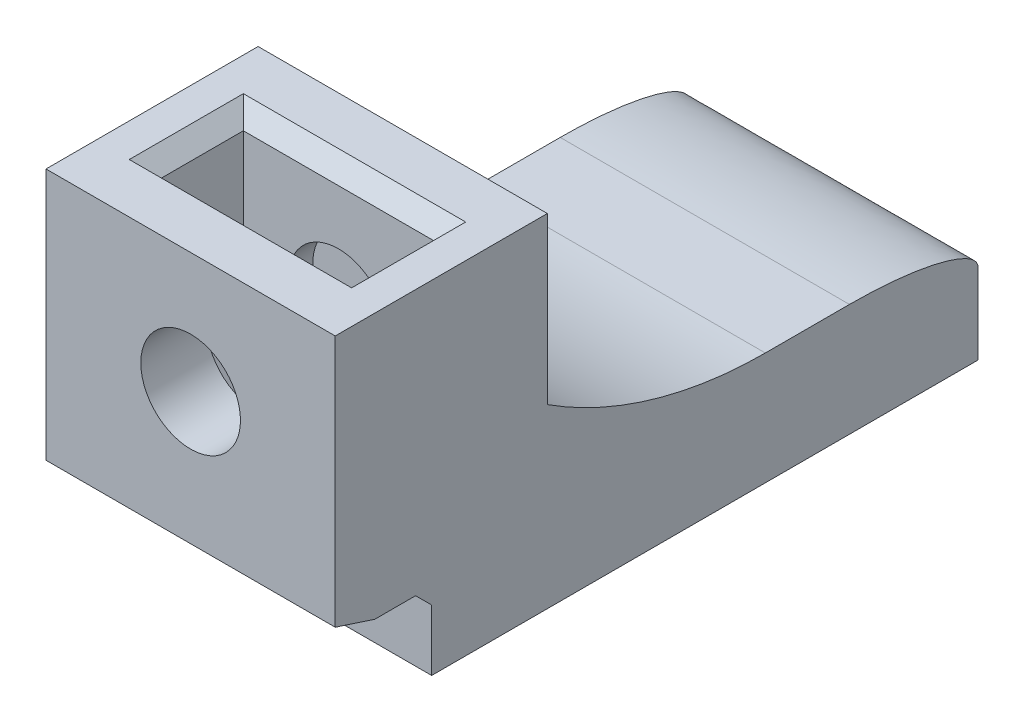
from build123d import *

# Parameters (mm, degrees)
RESSALTO_EXTRUS_O1_DEPTH = 9
CHANFRO5_SIZE            = 1
CHAMFER1_SIZE            = 0.8
CHAMFER1_SIZE2           = 2.46214683
ESBO_O3_R                = 3.1
CORTE_EXTRUS_O1_DEPTH    = 10.7
CORTE_EXTRUS_O4_START    = -4
CORTE_EXTRUS_O4_DEPTH    = 5.1
CHAMFER2_SIZE            = 1
FILETE1_SIZE             = 2
FILETE1_SIZE_2           = 8


with BuildPart() as part:
    # Esboço2 → Ressalto-extrusão1 (new, symmetric)
    with BuildSketch(Plane(origin=(0, 0, 0), x_dir=(0, 0, -1), z_dir=(1, 0, 0))):
        with BuildLine():
            Line((0, 0), (0, -16.5))
            Line((0, -16.5), (6, -16.5))
            Line((6, -16.5), (6, -21.3))
            Line((6, -21.3), (40, -21.3))
            Line((40, -21.3), (40, -14.3))
            Line((40, -14.3), (26.764659966, -14.3))
            ThreePointArc((26.764659966, -14.3), (19.693592154, -13.279157617), (13.2, -10.3))
            Line((13.2, -10.3), (13.2, 0))
            Line((13.2, 0), (0, 0))
        make_face()
    extrude(amount=RESSALTO_EXTRUS_O1_DEPTH, both=True)

    # Chanfro5
    chanfro5_edges = [part.edges().sort_by_distance(p)[0] for p in [
        (0, -16.5, -6),
    ]]
    chamfer(chanfro5_edges, length=CHANFRO5_SIZE)

    # Chamfer1
    chamfer1_edges = [part.edges().sort_by_distance(p)[0] for p in [
        (0, -16.5, 0),
    ]]
    chamfer1_side = [part.faces().sort_by_distance(p)[0] for p in [
        (0, -8.25, 0),
    ]]
    chamfer(chamfer1_edges, length=CHAMFER1_SIZE, length2=CHAMFER1_SIZE2, reference=chamfer1_side[0])

    # Esboço3 → Corte-extrusão1 (cut)
    with BuildSketch(Plane(origin=(0, 0, 0), x_dir=(-1, 0, 0), z_dir=(0, 0, -1))):
        with Locations(Location((0, -7.5, 0), (0, 0, 180))):
            Circle(ESBO_O3_R)
    extrude(amount=CORTE_EXTRUS_O1_DEPTH, mode=Mode.SUBTRACT)

    # Esboço7 → Corte-extrusão4 (cut)
    with BuildSketch(Plane(origin=(0, 0, -13.2), x_dir=(-1, 0, 0), z_dir=(0, 0, -1)).offset(CORTE_EXTRUS_O4_START)):
        Polygon((2.95892013, -2.375), (5.917840259, -7.5), (5.917840259, 0), (-5.917840259, 0), (-5.917840259, -7.5), (-2.95892013, -2.375), align=None)
        Polygon((2.95892013, -12.625), (5.917840259, -7.5), (2.95892013, -2.375), (-2.95892013, -2.375), (-5.917840259, -7.5), (-2.95892013, -12.625), align=None)
    extrude(amount=-CORTE_EXTRUS_O4_DEPTH, mode=Mode.SUBTRACT)

    # Chamfer2
    chamfer2_edges = [part.edges().sort_by_distance(p)[0] for p in [
        (0, 0, -4.1),
        (5.917840259, 0, -6.65),
        (-5.917840259, 0, -6.65),
        (0, 0, -9.2),
    ]]
    chamfer(chamfer2_edges, length=CHAMFER2_SIZE)

    # Filete1
    # an asymmetric fillet: 8, 2 mm, written as the material it takes off along each edge
    with BuildSketch(Plane(origin=(-29, -14.3, -40), x_dir=(0, -1, 0), z_dir=(1, 0, 0))) as filete1_piece_1:
        with BuildLine():
            Bezier((FILETE1_SIZE, 0), (0, 0), (0, -FILETE1_SIZE_2), weights=[1, 0.707106781, 1])
            Line((0, -FILETE1_SIZE_2), (0, 0))
            Line((0, 0), (FILETE1_SIZE, 0))
        make_face()
    extrude(amount=58, mode=Mode.SUBTRACT)


solid = part.part
